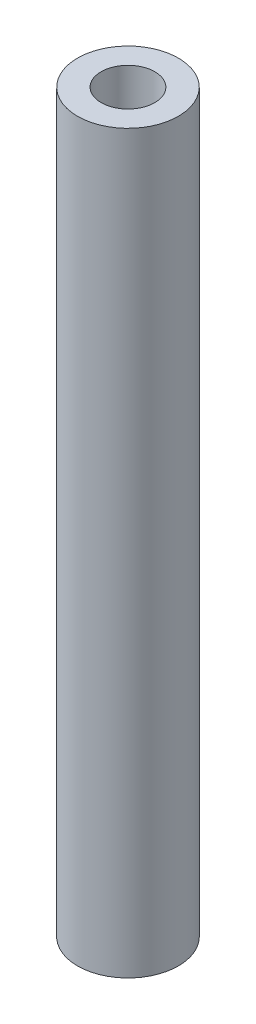
from build123d import *

# Parameters (mm, degrees)
SKETCH1_R           = 9.398
SKETCH1_R_2         = 5
BOSS_EXTRUDE1_DEPTH = 137.16


with BuildPart() as part:
    # Sketch1 → Boss-Extrude1 (new body)
    with BuildSketch(Plane(origin=(0, 0, 0), x_dir=(1, 0, 0), z_dir=(0, 1, 0))):
        Circle(SKETCH1_R)
        Circle(SKETCH1_R_2, mode=Mode.SUBTRACT)
    extrude(amount=BOSS_EXTRUDE1_DEPTH)


solid = part.part
